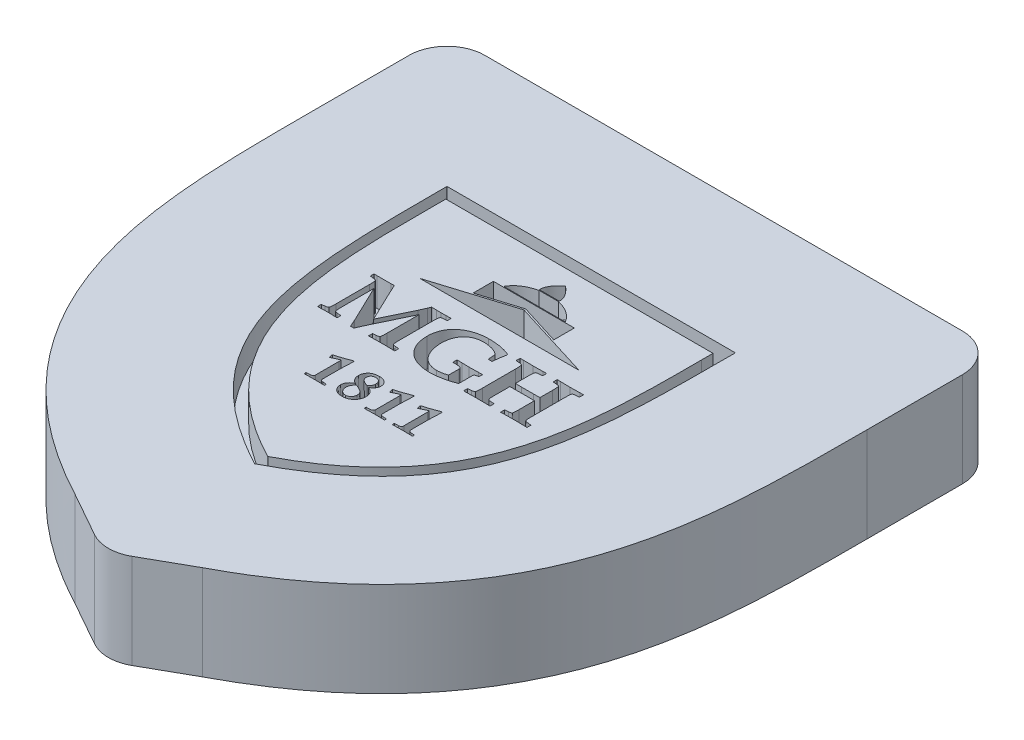
from build123d import *

# Parameters (mm, degrees)
SKETCH1_W           = 40
SKETCH1_H           = 40
BOSS_EXTRUDE1_DEPTH = 5
CUT_EXTRUDE1_START  = -1.5
CUT_EXTRUDE1_DEPTH  = 1.5
SKETCH4_W           = 40
SKETCH4_H           = 40
CUT_EXTRUDE2_DEPTH  = 29.722813372
FILLET1_R           = 2


# Read off the part's stored shape, not the designer's step: Cut-Extrude1
with BuildPart() as part:
    # Sketch1 → Boss-Extrude1 (new body)
    with BuildSketch(Plane(origin=(0, 0, 0), x_dir=(1, 0, 0), z_dir=(0, 1, 0))):
        Rectangle(SKETCH1_W, SKETCH1_H)
    extrude(amount=BOSS_EXTRUDE1_DEPTH)

    # Cut-Extrude1 outline → Cut-Extrude1 (cut)
    # profile 1 of 12: a face of its own
    with BuildSketch(Plane(origin=(0, 5, 0), x_dir=(1, 0, 0), z_dir=(0, 1, 0)).offset(CUT_EXTRUDE1_START)):
        with BuildLine():
            Line((-7.62, 8.88893), (-7.62, 8.85189))
            add(Edge.make_bspline(
                [(-7.62, 8.85189), (-7.62, 0.58209), (-7.62, -4.87999), (-0.01692, -8.88047)],
                knots=[0.125, 0.125, 0.125, 0.125, 0.25, 0.25, 0.25, 0.25], degree=3))
            Line((-0.01692, -8.88047), (0, -8.88999))
            Line((0, -8.88999), (0.01692, -8.88047))
            add(Edge.make_bspline(
                [(0.01692, -8.88047), (7.62, -4.89691), (7.62, 0.57361), (7.62, 8.85401)],
                knots=[0.5, 0.5, 0.5, 0.5, 0.625, 0.625, 0.625, 0.625], degree=3))
            Line((7.62, 8.85401), (7.62, 8.89105))
            Line((7.62, 8.89105), (-7.62, 8.88893))
        make_face()
        with BuildLine():
            add(Edge.make_bspline(
                [(-7.06968, 8.25181), (-7.06968, 8.02533), (-7.06968, 7.79885), (-7.07072, 7.57341)],
                knots=[0.25, 0.25, 0.25, 0.25, 0.333333333, 0.333333333, 0.333333333, 0.333333333], degree=3))
            Line((-7.06968, 8.25181), (-7.06968, 8.27721))
            Line((-7.06968, 8.27721), (7.0506, 8.27933))
            Line((7.0506, 8.27933), (7.0506, 7.66337))
            add(Edge.make_bspline(
                [(0.01692, -8.20103), (7.06436, -4.54027), (7.058, 1.38853), (7.0506, 7.66337)],
                knots=[0.75, 0.75, 0.75, 0.75, 0.833333333, 0.833333333, 0.833333333, 0.833333333], degree=3))
            Line((0.01692, -8.20103), (0.00528, -8.20739))
            Line((0.00528, -8.20739), (-0.00636, -8.20103))
            add(Edge.make_bspline(
                [(-4.09892, -5.06307), (-3.048, -6.29815), (-1.7092, -7.32471), (-0.00636, -8.20103)],
                knots=[0.5, 0.5, 0.5, 0.5, 0.583333333, 0.583333333, 0.583333333, 0.583333333], degree=3))
            add(Edge.make_bspline(
                [(-6.19864, -1.25095), (-5.72452, -2.71355), (-5.03764, -3.96027), (-4.09892, -5.06307)],
                knots=[0.416666667, 0.416666667, 0.416666667, 0.416666667, 0.5, 0.5, 0.5, 0.5], degree=3))
            add(Edge.make_bspline(
                [(-7.07072, 7.57341), (-7.076, 4.43337), (-7.08024, 1.46789), (-6.19864, -1.25095)],
                knots=[0.333333333, 0.333333333, 0.333333333, 0.333333333, 0.416666667, 0.416666667, 0.416666667, 0.416666667], degree=3))
        make_face(mode=Mode.SUBTRACT)
    # profile 2 of 12: a face of its own
    with BuildSketch(Plane(origin=(0, 5, 0), x_dir=(1, 0, 0), z_dir=(0, 1, 0)).offset(CUT_EXTRUDE1_START)):
        with BuildLine():
            add(Edge.make_bspline(
                [(-0.1334, -2.87547), (-0.1334, -2.58867), (-0.33132, -2.44579), (-0.48264, -2.39075)],
                knots=[0.555555556, 0.555555556, 0.555555556, 0.555555556, 0.666666667, 0.666666667, 0.666666667, 0.666666667], degree=3))
            add(Edge.make_bspline(
                [(-0.48264, -2.39075), (-0.32496, -2.29019), (-0.21804, -2.16531), (-0.21804, -2.00551)],
                knots=[0.666666667, 0.666666667, 0.666666667, 0.666666667, 0.777777778, 0.777777778, 0.777777778, 0.777777778], degree=3))
            add(Edge.make_bspline(
                [(-0.21804, -2.00551), (-0.218, -1.71875), (-0.44768, -1.59279), (-0.70804, -1.59279)],
                knots=[0.777777778, 0.777777778, 0.777777778, 0.777777778, 1, 1, 1, 1], degree=3))
            add(Edge.make_bspline(
                [(-0.70804, -1.59279), (-1.09008, -1.59279), (-1.30388, -1.80551), (-1.30388, -2.11559)],
                knots=[0, 0, 0, 0, 0.111111111, 0.111111111, 0.111111111, 0.111111111], degree=3))
            add(Edge.make_bspline(
                [(-1.30388, -2.11559), (-1.30388, -2.31775), (-1.19804, -2.45639), (-1.02344, -2.54843)],
                knots=[0.111111111, 0.111111111, 0.111111111, 0.111111111, 0.222222222, 0.222222222, 0.222222222, 0.222222222], degree=3))
            add(Edge.make_bspline(
                [(-1.02344, -2.54843), (-1.20336, -2.62779), (-1.3526, -2.79927), (-1.3526, -3.00459)],
                knots=[0.222222222, 0.222222222, 0.222222222, 0.222222222, 0.333333333, 0.333333333, 0.333333333, 0.333333333], degree=3))
            add(Edge.make_bspline(
                [(-1.3526, -3.00459), (-1.3526, -3.24591), (-1.18116, -3.49671), (-0.7864, -3.49671)],
                knots=[0.333333333, 0.333333333, 0.333333333, 0.333333333, 0.444444444, 0.444444444, 0.444444444, 0.444444444], degree=3))
            add(Edge.make_bspline(
                [(-0.7864, -3.49671), (-0.42656, -3.49671), (-0.1334, -3.24375), (-0.1334, -2.87547)],
                knots=[0.444444444, 0.444444444, 0.444444444, 0.444444444, 0.555555556, 0.555555556, 0.555555556, 0.555555556], degree=3))
        make_face()
        with BuildLine():
            add(Edge.make_bspline(
                [(-0.4424, -3.03107), (-0.4424, -3.20251), (-0.56624, -3.35175), (-0.74404, -3.35175)],
                knots=[0.166666667, 0.166666667, 0.166666667, 0.166666667, 0.333333333, 0.333333333, 0.333333333, 0.333333333], degree=3))
            add(Edge.make_bspline(
                [(-0.74404, -3.35175), (-0.95464, -3.35175), (-1.10068, -3.18243), (-1.10068, -2.97711)],
                knots=[0.333333333, 0.333333333, 0.333333333, 0.333333333, 0.5, 0.5, 0.5, 0.5], degree=3))
            add(Edge.make_bspline(
                [(-1.10068, -2.97711), (-1.10068, -2.80459), (-1.03296, -2.70619), (-0.907, -2.59927)],
                knots=[0.5, 0.5, 0.5, 0.5, 0.666666667, 0.666666667, 0.666666667, 0.666666667], degree=3))
            Line((-0.907, -2.59927), (-0.73556, -2.67547))
            add(Edge.make_bspline(
                [(-0.73556, -2.67547), (-0.57576, -2.74639), (-0.4424, -2.83423), (-0.4424, -3.03107)],
                knots=[0, 0, 0, 0, 0.166666667, 0.166666667, 0.166666667, 0.166666667], degree=3))
        make_face(mode=Mode.SUBTRACT)
        with BuildLine():
            add(Edge.make_bspline(
                [(-1.01388, -1.98863), (-1.01388, -1.82883), (-0.89852, -1.73887), (-0.744, -1.73887)],
                knots=[0.166666667, 0.166666667, 0.166666667, 0.166666667, 0.333333333, 0.333333333, 0.333333333, 0.333333333], degree=3))
            add(Edge.make_bspline(
                [(-0.744, -1.73887), (-0.56092, -1.73887), (-0.454, -1.86799), (-0.454, -2.04471)],
                knots=[0.333333333, 0.333333333, 0.333333333, 0.333333333, 0.5, 0.5, 0.5, 0.5], degree=3))
            add(Edge.make_bspline(
                [(-0.454, -2.04471), (-0.454, -2.15795), (-0.51116, -2.25639), (-0.62016, -2.34315)],
                knots=[0.5, 0.5, 0.5, 0.5, 0.666666667, 0.666666667, 0.666666667, 0.666666667], degree=3))
            Line((-0.62016, -2.34315), (-0.744, -2.29131))
            add(Edge.make_bspline(
                [(-0.744, -2.29131), (-0.87628, -2.23415), (-1.01388, -2.15795), (-1.01388, -1.98863)],
                knots=[0, 0, 0, 0, 0.166666667, 0.166666667, 0.166666667, 0.166666667], degree=3))
        make_face(mode=Mode.SUBTRACT)
    # profile 3 of 12: a face of its own
    with BuildSketch(Plane(origin=(0, 5, 0), x_dir=(1, 0, 0), z_dir=(0, 1, 0)).offset(CUT_EXTRUDE1_START)):
        with BuildLine():
            Line((2.59816, -1.59279), (2.56428, -1.56315))
            add(Edge.make_bspline(
                [(2.56428, -1.56315), (2.32296, -1.65947), (1.92928, -1.79915), (1.72292, -1.84783)],
                knots=[0.764705882, 0.764705882, 0.764705882, 0.764705882, 0.823529412, 0.823529412, 0.823529412, 0.823529412], degree=3))
            add(Edge.make_bspline(
                [(1.72292, -1.84783), (1.71976, -1.90711), (1.7314, -1.96955), (1.76312, -2.04467)],
                knots=[0.823529412, 0.823529412, 0.823529412, 0.823529412, 0.882352941, 0.882352941, 0.882352941, 0.882352941], degree=3))
            Line((1.76312, -2.04467), (2.15584, -1.86267))
            add(Edge.make_bspline(
                [(2.15584, -1.86267), (2.20028, -1.84255), (2.19816, -1.90711), (2.19816, -1.96639)],
                knots=[0, 0, 0, 0, 0.058823529, 0.058823529, 0.058823529, 0.058823529], degree=3))
            Line((2.19816, -1.96639), (2.19816, -3.21203))
            add(Edge.make_bspline(
                [(2.19816, -3.21203), (2.19816, -3.30727), (2.12832, -3.33903), (2.03836, -3.34431)],
                knots=[0.117647059, 0.117647059, 0.117647059, 0.117647059, 0.176470588, 0.176470588, 0.176470588, 0.176470588], degree=3))
            Line((2.03836, -3.34431), (1.8362, -3.35279))
            Line((1.8362, -3.35279), (1.8362, -3.45755))
            add(Edge.make_bspline(
                [(1.8362, -3.45755), (2.16536, -3.45439), (2.28704, -3.44907), (2.40664, -3.44907)],
                knots=[0.294117647, 0.294117647, 0.294117647, 0.294117647, 0.352941176, 0.352941176, 0.352941176, 0.352941176], degree=3))
            add(Edge.make_bspline(
                [(2.40664, -3.44907), (2.53048, -3.44907), (2.649, -3.45435), (2.90616, -3.45755)],
                knots=[0.352941176, 0.352941176, 0.352941176, 0.352941176, 0.411764706, 0.411764706, 0.411764706, 0.411764706], degree=3))
            Line((2.90616, -3.45755), (2.90616, -3.35279))
            Line((2.90616, -3.35279), (2.73048, -3.34431))
            add(Edge.make_bspline(
                [(2.73048, -3.34431), (2.64052, -3.33903), (2.5696, -3.30831), (2.5696, -3.21203)],
                knots=[0.529411765, 0.529411765, 0.529411765, 0.529411765, 0.588235294, 0.588235294, 0.588235294, 0.588235294], degree=3))
            Line((2.5696, -3.21203), (2.5696, -2.30611))
            add(Edge.make_bspline(
                [(2.5696, -2.30611), (2.5696, -1.96955), (2.58864, -1.72827), (2.59816, -1.59279)],
                knots=[0.647058824, 0.647058824, 0.647058824, 0.647058824, 0.705882353, 0.705882353, 0.705882353, 0.705882353], degree=3))
        make_face()
    # profile 4 of 12: a face of its own
    with BuildSketch(Plane(origin=(0, 5, 0), x_dir=(1, 0, 0), z_dir=(0, 1, 0)).offset(CUT_EXTRUDE1_START)):
        with BuildLine():
            Line((1.11444, -1.59279), (1.08056, -1.56315))
            add(Edge.make_bspline(
                [(1.08056, -1.56315), (0.83924, -1.65947), (0.44556, -1.79915), (0.2392, -1.84783)],
                knots=[0.764705882, 0.764705882, 0.764705882, 0.764705882, 0.823529412, 0.823529412, 0.823529412, 0.823529412], degree=3))
            add(Edge.make_bspline(
                [(0.2392, -1.84783), (0.23708, -1.90711), (0.24768, -1.96955), (0.2794, -2.04467)],
                knots=[0.823529412, 0.823529412, 0.823529412, 0.823529412, 0.882352941, 0.882352941, 0.882352941, 0.882352941], degree=3))
            Line((0.2794, -2.04467), (0.67204, -1.86267))
            add(Edge.make_bspline(
                [(0.67204, -1.86267), (0.71648, -1.84255), (0.71436, -1.90711), (0.71436, -1.96639)],
                knots=[0, 0, 0, 0, 0.058823529, 0.058823529, 0.058823529, 0.058823529], degree=3))
            Line((0.71436, -1.96639), (0.71436, -3.21203))
            add(Edge.make_bspline(
                [(0.71436, -3.21203), (0.71436, -3.30727), (0.64452, -3.33903), (0.55456, -3.34431)],
                knots=[0.117647059, 0.117647059, 0.117647059, 0.117647059, 0.176470588, 0.176470588, 0.176470588, 0.176470588], degree=3))
            Line((0.55456, -3.34431), (0.35136, -3.35279))
            Line((0.35136, -3.35279), (0.35136, -3.45755))
            add(Edge.make_bspline(
                [(0.35136, -3.45755), (0.68052, -3.45439), (0.8022, -3.44907), (0.92288, -3.44907)],
                knots=[0.294117647, 0.294117647, 0.294117647, 0.294117647, 0.352941176, 0.352941176, 0.352941176, 0.352941176], degree=3))
            add(Edge.make_bspline(
                [(0.92288, -3.44907), (1.04672, -3.44907), (1.16524, -3.45435), (1.4224, -3.45755)],
                knots=[0.352941176, 0.352941176, 0.352941176, 0.352941176, 0.411764706, 0.411764706, 0.411764706, 0.411764706], degree=3))
            Line((1.4224, -3.45755), (1.4224, -3.35279))
            Line((1.4224, -3.35279), (1.24672, -3.34431))
            add(Edge.make_bspline(
                [(1.24672, -3.34431), (1.15676, -3.33903), (1.08692, -3.30831), (1.08692, -3.21203)],
                knots=[0.529411765, 0.529411765, 0.529411765, 0.529411765, 0.588235294, 0.588235294, 0.588235294, 0.588235294], degree=3))
            Line((1.08692, -3.21203), (1.08692, -2.30611))
            add(Edge.make_bspline(
                [(1.08692, -2.30611), (1.08692, -1.96955), (1.10596, -1.72827), (1.11444, -1.59279)],
                knots=[0.647058824, 0.647058824, 0.647058824, 0.647058824, 0.705882353, 0.705882353, 0.705882353, 0.705882353], degree=3))
        make_face()
    # profile 5 of 12: a face of its own
    with BuildSketch(Plane(origin=(0, 5, 0), x_dir=(1, 0, 0), z_dir=(0, 1, 0)).offset(CUT_EXTRUDE1_START)):
        with BuildLine():
            add(Edge.make_bspline(
                [(-1.6478, 0.20109), (-1.74624, 0.20849), (-1.7928, 0.22333), (-1.8076, 0.24977)],
                knots=[0.924242424, 0.924242424, 0.924242424, 0.924242424, 0.939393939, 0.939393939, 0.939393939, 0.939393939], degree=3))
            add(Edge.make_bspline(
                [(-1.8076, 0.24977), (-1.83088, 0.29633), (-1.83512, 0.41381), (-1.83512, 0.58845)],
                knots=[0.939393939, 0.939393939, 0.939393939, 0.939393939, 0.954545455, 0.954545455, 0.954545455, 0.954545455], degree=3))
            Line((-1.83512, 0.58845), (-1.83512, 2.34529))
            add(Edge.make_bspline(
                [(-1.83512, 2.34529), (-1.83304, 2.52097), (-1.8288, 2.63421), (-1.80552, 2.68181)],
                knots=[0.96969697, 0.96969697, 0.96969697, 0.96969697, 1, 1, 1, 1], degree=3))
            add(Edge.make_bspline(
                [(-1.80552, 2.68181), (-1.78964, 2.71357), (-1.75788, 2.73365), (-1.64572, 2.74321)],
                knots=[0, 0, 0, 0, 0.015151515, 0.015151515, 0.015151515, 0.015151515], degree=3))
            Line((-1.64572, 2.74321), (-1.46688, 2.75801))
            Line((-1.46688, 2.75801), (-1.46688, 2.95909))
            Line((-1.46688, 2.95909), (-1.48912, 2.95909))
            add(Edge.make_bspline(
                [(-1.48912, 2.95909), (-1.57908, 2.95697), (-1.65844, 2.95485), (-1.73044, 2.95169)],
                knots=[0.060606061, 0.060606061, 0.060606061, 0.060606061, 0.075757576, 0.075757576, 0.075757576, 0.075757576], degree=3))
            add(Edge.make_bspline(
                [(-1.73044, 2.95169), (-1.82888, 2.94853), (-1.9146, 2.94533), (-1.98868, 2.94533)],
                knots=[0.075757576, 0.075757576, 0.075757576, 0.075757576, 0.090909091, 0.090909091, 0.090909091, 0.090909091], degree=3))
            add(Edge.make_bspline(
                [(-1.98868, 2.94533), (-2.06172, 2.94533), (-2.14848, 2.94849), (-2.24796, 2.95169)],
                knots=[0.090909091, 0.090909091, 0.090909091, 0.090909091, 0.106060606, 0.106060606, 0.106060606, 0.106060606], degree=3))
            add(Edge.make_bspline(
                [(-2.24796, 2.95169), (-2.31888, 2.95381), (-2.39612, 2.95697), (-2.48292, 2.95805)],
                knots=[0.106060606, 0.106060606, 0.106060606, 0.106060606, 0.121212121, 0.121212121, 0.121212121, 0.121212121], degree=3))
            Line((-2.48292, 2.95805), (-2.49772, 2.95805))
            Line((-2.49772, 2.95805), (-2.503, 2.94429))
            add(Edge.make_bspline(
                [(-2.503, 2.94429), (-2.52204, 2.90089), (-2.54112, 2.85537), (-2.56016, 2.80777)],
                knots=[0.151515152, 0.151515152, 0.151515152, 0.151515152, 0.166666667, 0.166666667, 0.166666667, 0.166666667], degree=3))
            add(Edge.make_bspline(
                [(-2.56016, 2.80777), (-2.60884, 2.69137), (-2.6586, 2.57069), (-2.7136, 2.45853)],
                knots=[0.166666667, 0.166666667, 0.166666667, 0.166666667, 0.181818182, 0.181818182, 0.181818182, 0.181818182], degree=3))
            Line((-2.7136, 2.45853), (-3.483, 0.87101))
            Line((-3.483, 0.87101), (-4.1434, 2.25109))
            add(Edge.make_bspline(
                [(-4.1434, 2.25109), (-4.17408, 2.31669), (-4.21112, 2.39609), (-4.25136, 2.47969)],
                knots=[0.212121212, 0.212121212, 0.212121212, 0.212121212, 0.227272727, 0.227272727, 0.227272727, 0.227272727], degree=3))
            add(Edge.make_bspline(
                [(-4.25136, 2.47969), (-4.3286, 2.64269), (-4.4154, 2.82789), (-4.46728, 2.94429)],
                knots=[0.227272727, 0.227272727, 0.227272727, 0.227272727, 0.242424242, 0.242424242, 0.242424242, 0.242424242], degree=3))
            Line((-4.46728, 2.94429), (-4.47364, 2.95805))
            Line((-4.47364, 2.95805), (-4.4874, 2.95805))
            add(Edge.make_bspline(
                [(-4.4874, 2.95805), (-4.53504, 2.95701), (-4.58264, 2.95489), (-4.63132, 2.95381)],
                knots=[0.272727273, 0.272727273, 0.272727273, 0.272727273, 0.287878788, 0.287878788, 0.287878788, 0.287878788], degree=3))
            add(Edge.make_bspline(
                [(-4.63132, 2.95381), (-4.87368, 2.94533), (-5.1298, 2.94429), (-5.37532, 2.95381)],
                knots=[0.287878788, 0.287878788, 0.287878788, 0.287878788, 0.303030303, 0.303030303, 0.303030303, 0.303030303], degree=3))
            add(Edge.make_bspline(
                [(-5.37532, 2.95381), (-5.424, 2.95485), (-5.47164, 2.95697), (-5.52032, 2.95805)],
                knots=[0.303030303, 0.303030303, 0.303030303, 0.303030303, 0.318181818, 0.318181818, 0.318181818, 0.318181818], degree=3))
            Line((-5.52032, 2.95805), (-5.54256, 2.95805))
            Line((-5.54256, 2.95805), (-5.54256, 2.75697))
            Line((-5.54256, 2.75697), (-5.36372, 2.74217))
            add(Edge.make_bspline(
                [(-5.36372, 2.74217), (-5.2526, 2.73369), (-5.22084, 2.71253), (-5.20392, 2.68185)],
                knots=[0.363636364, 0.363636364, 0.363636364, 0.363636364, 0.378787879, 0.378787879, 0.378787879, 0.378787879], degree=3))
            add(Edge.make_bspline(
                [(-5.20392, 2.68185), (-5.18168, 2.63317), (-5.1764, 2.52097), (-5.1764, 2.34213)],
                knots=[0.378787879, 0.378787879, 0.378787879, 0.378787879, 0.393939394, 0.393939394, 0.393939394, 0.393939394], degree=3))
            Line((-5.1764, 2.34213), (-5.1764, 0.58529))
            add(Edge.make_bspline(
                [(-5.1764, 0.58529), (-5.1764, 0.41065), (-5.18064, 0.29317), (-5.20392, 0.24769)],
                knots=[0.409090909, 0.409090909, 0.409090909, 0.409090909, 0.424242424, 0.424242424, 0.424242424, 0.424242424], degree=3))
            add(Edge.make_bspline(
                [(-5.20392, 0.24769), (-5.22084, 0.21489), (-5.2526, 0.19373), (-5.36372, 0.18525)],
                knots=[0.424242424, 0.424242424, 0.424242424, 0.424242424, 0.439393939, 0.439393939, 0.439393939, 0.439393939], degree=3))
            Line((-5.36372, 0.18525), (-5.54256, 0.17045))
            Line((-5.54256, 0.17045), (-5.54256, -0.03063))
            Line((-5.54256, -0.03063), (-5.52032, -0.03063))
            add(Edge.make_bspline(
                [(-5.52032, -0.03063), (-5.46848, -0.02959), (-5.41556, -0.02747), (-5.36264, -0.02535)],
                knots=[0.484848485, 0.484848485, 0.484848485, 0.484848485, 0.5, 0.5, 0.5, 0.5], degree=3))
            add(Edge.make_bspline(
                [(-5.36264, -0.02535), (-5.25152, -0.02111), (-5.1372, -0.01687), (-5.02608, -0.01687)],
                knots=[0.5, 0.5, 0.5, 0.5, 0.515151515, 0.515151515, 0.515151515, 0.515151515], degree=3))
            add(Edge.make_bspline(
                [(-5.02608, -0.01687), (-4.91496, -0.01687), (-4.80276, -0.02111), (-4.69376, -0.02535)],
                knots=[0.515151515, 0.515151515, 0.515151515, 0.515151515, 0.53030303, 0.53030303, 0.53030303, 0.53030303], degree=3))
            add(Edge.make_bspline(
                [(-4.69376, -0.02535), (-4.64084, -0.02747), (-4.58792, -0.02959), (-4.535, -0.03063)],
                knots=[0.53030303, 0.53030303, 0.53030303, 0.53030303, 0.545454545, 0.545454545, 0.545454545, 0.545454545], degree=3))
            Line((-4.535, -0.03063), (-4.51276, -0.03063))
            Line((-4.51276, -0.03063), (-4.51276, 0.17045))
            Line((-4.51276, 0.17045), (-4.69268, 0.18525))
            add(Edge.make_bspline(
                [(-4.69268, 0.18525), (-4.80276, 0.19373), (-4.83556, 0.21489), (-4.85248, 0.24665)],
                knots=[0.590909091, 0.590909091, 0.590909091, 0.590909091, 0.606060606, 0.606060606, 0.606060606, 0.606060606], degree=3))
            add(Edge.make_bspline(
                [(-4.85248, 0.24665), (-4.87576, 0.29321), (-4.88, 0.41069), (-4.88, 0.58533)],
                knots=[0.606060606, 0.606060606, 0.606060606, 0.606060606, 0.621212121, 0.621212121, 0.621212121, 0.621212121], degree=3))
            Line((-4.88, 0.58533), (-4.87996, 2.28813))
            Line((-4.87996, 2.28813), (-3.93064, 0.31009))
            Line((-3.93064, 0.31009), (-3.91372, 0.27409))
            add(Edge.make_bspline(
                [(-3.91372, 0.27409), (-3.86292, 0.16509), (-3.81528, 0.06241), (-3.7772, -0.04551)],
                knots=[0.666666667, 0.666666667, 0.666666667, 0.666666667, 0.681818182, 0.681818182, 0.681818182, 0.681818182], degree=3))
            Line((-3.7772, -0.04551), (-3.77192, -0.05927))
            Line((-3.77192, -0.05927), (-3.59516, -0.05927))
            Line((-3.59516, -0.05927), (-3.58988, -0.04551))
            add(Edge.make_bspline(
                [(-3.58988, -0.04551), (-3.53272, 0.09841), (-3.44808, 0.28469), (-3.33272, 0.52281)],
                knots=[0.727272727, 0.727272727, 0.727272727, 0.727272727, 0.742424242, 0.742424242, 0.742424242, 0.742424242], degree=3))
            Line((-3.33272, 0.52281), (-2.48604, 2.28493))
            Line((-2.48604, 2.28493), (-2.48604, 0.58737))
            add(Edge.make_bspline(
                [(-2.48604, 0.58737), (-2.48604, 0.41273), (-2.49028, 0.29525), (-2.51356, 0.24977)],
                knots=[0.772727273, 0.772727273, 0.772727273, 0.772727273, 0.787878788, 0.787878788, 0.787878788, 0.787878788], degree=3))
            add(Edge.make_bspline(
                [(-2.51356, 0.24977), (-2.52732, 0.22225), (-2.57388, 0.20745), (-2.67232, 0.20109)],
                knots=[0.787878788, 0.787878788, 0.787878788, 0.787878788, 0.803030303, 0.803030303, 0.803030303, 0.803030303], degree=3))
            Line((-2.67232, 0.20109), (-2.85116, 0.18629))
            Line((-2.85116, 0.18629), (-2.85116, -0.02751))
            Line((-2.85116, -0.02751), (-2.71356, -0.02435))
            add(Edge.make_bspline(
                [(-2.71356, -0.02435), (-2.55692, -0.02011), (-2.36324, -0.01483), (-2.15792, -0.01483)],
                knots=[0.848484848, 0.848484848, 0.848484848, 0.848484848, 0.863636364, 0.863636364, 0.863636364, 0.863636364], degree=3))
            add(Edge.make_bspline(
                [(-2.15792, -0.01483), (-1.95788, -0.01483), (-1.7642, -0.02011), (-1.60864, -0.02435)],
                knots=[0.863636364, 0.863636364, 0.863636364, 0.863636364, 0.878787879, 0.878787879, 0.878787879, 0.878787879], degree=3))
            Line((-1.60864, -0.02435), (-1.46788, -0.02751))
            Line((-1.46788, -0.02751), (-1.46788, 0.18629))
            Line((-1.46788, 0.18629), (-1.6478, 0.20109))
        make_face()
    # profile 6 of 12: a face of its own
    with BuildSketch(Plane(origin=(0, 5, 0), x_dir=(1, 0, 0), z_dir=(0, 1, 0)).offset(CUT_EXTRUDE1_START)):
        with BuildLine():
            add(Edge.make_bspline(
                [(-1.29016, 1.51233), (-1.29016, 0.52489), (-0.62872, -0.08891), (0.436, -0.08891)],
                knots=[0.71875, 0.71875, 0.71875, 0.71875, 0.75, 0.75, 0.75, 0.75], degree=3))
            add(Edge.make_bspline(
                [(0.436, -0.08891), (0.83816, -0.08891), (1.25196, -0.00423), (1.70072, 0.16933)],
                knots=[0.75, 0.75, 0.75, 0.75, 0.78125, 0.78125, 0.78125, 0.78125], degree=3))
            Line((1.70072, 0.16933), (1.71448, 0.17461))
            Line((1.71448, 0.17461), (1.71448, 0.89217))
            add(Edge.make_bspline(
                [(1.71448, 0.89217), (1.71448, 0.98001), (1.76632, 0.99481), (1.91768, 1.02553)],
                knots=[0.84375, 0.84375, 0.84375, 0.84375, 0.875, 0.875, 0.875, 0.875], degree=3))
            Line((1.91768, 1.02553), (1.9346, 1.02869))
            Line((1.9346, 1.02869), (1.9346, 1.21497))
            Line((1.9346, 1.21497), (1.91348, 1.21389))
            add(Edge.make_bspline(
                [(1.91348, 1.21389), (1.85316, 1.21285), (1.78964, 1.21073), (1.72404, 1.20965)],
                knots=[0, 0, 0, 0, 0.03125, 0.03125, 0.03125, 0.03125], degree=3))
            add(Edge.make_bspline(
                [(1.72404, 1.20965), (1.56104, 1.20541), (1.39068, 1.20117), (1.2404, 1.20117)],
                knots=[0.03125, 0.03125, 0.03125, 0.03125, 0.0625, 0.0625, 0.0625, 0.0625], degree=3))
            add(Edge.make_bspline(
                [(1.2404, 1.20117), (1.11128, 1.20117), (0.979, 1.20433), (0.85092, 1.20857)],
                knots=[0.0625, 0.0625, 0.0625, 0.0625, 0.09375, 0.09375, 0.09375, 0.09375], degree=3))
            Line((0.85092, 1.20857), (0.60856, 1.21493))
            Line((0.60856, 1.21493), (0.58632, 1.21493))
            Line((0.58632, 1.21493), (0.58632, 0.99585))
            Line((0.58632, 0.99585), (0.83396, 0.98633))
            add(Edge.make_bspline(
                [(0.83396, 0.98633), (0.98, 0.98105), (1.05832, 0.95669), (1.05832, 0.84769)],
                knots=[0.21875, 0.21875, 0.21875, 0.21875, 0.25, 0.25, 0.25, 0.25], degree=3))
            Line((1.05832, 0.84769), (1.05832, 0.29525))
            add(Edge.make_bspline(
                [(1.05832, 0.29525), (0.87312, 0.22645), (0.70588, 0.19365), (0.5334, 0.19365)],
                knots=[0.28125, 0.28125, 0.28125, 0.28125, 0.3125, 0.3125, 0.3125, 0.3125], degree=3))
            add(Edge.make_bspline(
                [(0.5334, 0.19365), (-0.3048, 0.19365), (-0.6022, 0.93341), (-0.6022, 1.56737)],
                knots=[0.3125, 0.3125, 0.3125, 0.3125, 0.34375, 0.34375, 0.34375, 0.34375], degree=3))
            add(Edge.make_bspline(
                [(-0.6022, 1.56737), (-0.6022, 2.28705), (-0.19156, 2.73365), (0.46988, 2.73365)],
                knots=[0.34375, 0.34375, 0.34375, 0.34375, 0.375, 0.375, 0.375, 0.375], degree=3))
            add(Edge.make_bspline(
                [(0.46988, 2.73365), (0.85616, 2.73365), (1.2012, 2.62253), (1.3536, 2.44897)],
                knots=[0.375, 0.375, 0.375, 0.375, 0.40625, 0.40625, 0.40625, 0.40625], degree=3))
            Line((1.3536, 2.44897), (1.37476, 2.08701))
            Line((1.37476, 2.08701), (1.37584, 2.06797))
            Line((1.37584, 2.06797), (1.5822, 2.06797))
            Line((1.5822, 2.06797), (1.59172, 2.15369))
            add(Edge.make_bspline(
                [(1.59172, 2.15369), (1.61396, 2.34421), (1.64568, 2.60561), (1.68272, 2.74213)],
                knots=[0.53125, 0.53125, 0.53125, 0.53125, 0.5625, 0.5625, 0.5625, 0.5625], degree=3))
            Line((1.68272, 2.74213), (1.68588, 2.75061))
            Line((1.68588, 2.75061), (1.652, 2.81093))
            Line((1.652, 2.81093), (1.64564, 2.81409))
            add(Edge.make_bspline(
                [(1.64564, 2.81409), (1.20856, 2.99401), (0.79792, 3.01833), (0.45396, 3.01833)],
                knots=[0.65625, 0.65625, 0.65625, 0.65625, 0.6875, 0.6875, 0.6875, 0.6875], degree=3))
            add(Edge.make_bspline(
                [(0.45396, 3.01833), (-0.41388, 3.01833), (-1.29016, 2.55265), (-1.29016, 1.51233)],
                knots=[0.6875, 0.6875, 0.6875, 0.6875, 0.71875, 0.71875, 0.71875, 0.71875], degree=3))
        make_face()
    # profile 7 of 12: a face of its own
    with BuildSketch(Plane(origin=(0, 5, 0), x_dir=(1, 0, 0), z_dir=(0, 1, 0)).offset(CUT_EXTRUDE1_START)):
        with BuildLine():
            add(Edge.make_bspline(
                [(5.3478, 0.19681), (5.24724, 0.20529), (5.20068, 0.21905), (5.188, 0.24657)],
                knots=[0.923076923, 0.923076923, 0.923076923, 0.923076923, 0.938461538, 0.938461538, 0.938461538, 0.938461538], degree=3))
            add(Edge.make_bspline(
                [(5.188, 0.24657), (5.16156, 0.29633), (5.15944, 0.42965), (5.15944, 0.58525)],
                knots=[0.938461538, 0.938461538, 0.938461538, 0.938461538, 0.953846154, 0.953846154, 0.953846154, 0.953846154], degree=3))
            Line((5.15944, 0.58525), (5.15944, 2.34209))
            add(Edge.make_bspline(
                [(5.15944, 2.34209), (5.16148, 2.49873), (5.1636, 2.63209), (5.19008, 2.68181)],
                knots=[0.969230769, 0.969230769, 0.969230769, 0.969230769, 1, 1, 1, 1], degree=3))
            add(Edge.make_bspline(
                [(5.19008, 2.68181), (5.20384, 2.70825), (5.25148, 2.72309), (5.34988, 2.73049)],
                knots=[0, 0, 0, 0, 0.015384615, 0.015384615, 0.015384615, 0.015384615], degree=3))
            Line((5.34988, 2.73049), (5.53084, 2.74529))
            Line((5.53084, 2.74529), (5.53084, 2.95801))
            Line((5.53084, 2.95801), (5.5086, 2.95801))
            add(Edge.make_bspline(
                [(5.5086, 2.95801), (5.45992, 2.95697), (5.407, 2.95589), (5.34984, 2.95485)],
                knots=[0.061538462, 0.061538462, 0.061538462, 0.061538462, 0.076923077, 0.076923077, 0.076923077, 0.076923077], degree=3))
            add(Edge.make_bspline(
                [(5.34984, 2.95485), (5.1964, 2.95061), (5.02068, 2.94637), (4.83444, 2.94637)],
                knots=[0.076923077, 0.076923077, 0.076923077, 0.076923077, 0.092307692, 0.092307692, 0.092307692, 0.092307692], degree=3))
            add(Edge.make_bspline(
                [(4.83444, 2.94637), (4.645, 2.94637), (4.47036, 2.95061), (4.3148, 2.95485)],
                knots=[0.092307692, 0.092307692, 0.092307692, 0.092307692, 0.107692308, 0.107692308, 0.107692308, 0.107692308], degree=3))
            add(Edge.make_bspline(
                [(4.3148, 2.95485), (4.25764, 2.95589), (4.20472, 2.95801), (4.15712, 2.95801)],
                knots=[0.107692308, 0.107692308, 0.107692308, 0.107692308, 0.123076923, 0.123076923, 0.123076923, 0.123076923], degree=3))
            Line((4.15712, 2.95801), (4.13488, 2.95801))
            Line((4.13488, 2.95801), (4.13488, 2.74529))
            Line((4.13488, 2.74529), (4.3148, 2.73049))
            add(Edge.make_bspline(
                [(4.3148, 2.73049), (4.41428, 2.72309), (4.46192, 2.70825), (4.47568, 2.68181)],
                knots=[0.169230769, 0.169230769, 0.169230769, 0.169230769, 0.184615385, 0.184615385, 0.184615385, 0.184615385], degree=3))
            add(Edge.make_bspline(
                [(4.47568, 2.68181), (4.50108, 2.63101), (4.5032, 2.49237), (4.5032, 2.34209)],
                knots=[0.184615385, 0.184615385, 0.184615385, 0.184615385, 0.2, 0.2, 0.2, 0.2], degree=3))
            Line((4.5032, 2.34209), (4.5032, 1.68169))
            add(Edge.make_bspline(
                [(4.5032, 1.68169), (4.44076, 1.67853), (4.35608, 1.67429), (4.173, 1.67429)],
                knots=[0.215384615, 0.215384615, 0.215384615, 0.215384615, 0.230769231, 0.230769231, 0.230769231, 0.230769231], degree=3))
            Line((4.173, 1.67429), (3.53696, 1.67429))
            add(Edge.make_bspline(
                [(3.53696, 1.67429), (3.35388, 1.67429), (3.2692, 1.67853), (3.20676, 1.68169)],
                knots=[0.246153846, 0.246153846, 0.246153846, 0.246153846, 0.261538462, 0.261538462, 0.261538462, 0.261538462], degree=3))
            Line((3.20676, 1.68169), (3.20676, 2.34209))
            add(Edge.make_bspline(
                [(3.20676, 2.34209), (3.20676, 2.49873), (3.20888, 2.63209), (3.23428, 2.68181)],
                knots=[0.276923077, 0.276923077, 0.276923077, 0.276923077, 0.292307692, 0.292307692, 0.292307692, 0.292307692], degree=3))
            add(Edge.make_bspline(
                [(3.23428, 2.68181), (3.24804, 2.70825), (3.29568, 2.72309), (3.3962, 2.73049)],
                knots=[0.292307692, 0.292307692, 0.292307692, 0.292307692, 0.307692308, 0.307692308, 0.307692308, 0.307692308], degree=3))
            Line((3.3962, 2.73049), (3.57612, 2.74529))
            Line((3.57612, 2.74529), (3.57612, 2.95801))
            Line((3.57612, 2.95801), (3.55388, 2.95801))
            add(Edge.make_bspline(
                [(3.55388, 2.95801), (3.5052, 2.95697), (3.45124, 2.95589), (3.39408, 2.95485)],
                knots=[0.353846154, 0.353846154, 0.353846154, 0.353846154, 0.369230769, 0.369230769, 0.369230769, 0.369230769], degree=3))
            add(Edge.make_bspline(
                [(3.39408, 2.95485), (3.24064, 2.95061), (3.066, 2.94637), (2.88184, 2.94637)],
                knots=[0.369230769, 0.369230769, 0.369230769, 0.369230769, 0.384615385, 0.384615385, 0.384615385, 0.384615385], degree=3))
            add(Edge.make_bspline(
                [(2.88184, 2.94637), (2.6924, 2.94637), (2.51564, 2.95061), (2.36112, 2.95485)],
                knots=[0.384615385, 0.384615385, 0.384615385, 0.384615385, 0.4, 0.4, 0.4, 0.4], degree=3))
            add(Edge.make_bspline(
                [(2.36112, 2.95485), (2.30504, 2.95589), (2.25212, 2.95801), (2.20344, 2.95801)],
                knots=[0.4, 0.4, 0.4, 0.4, 0.415384615, 0.415384615, 0.415384615, 0.415384615], degree=3))
            Line((2.20344, 2.95801), (2.1812, 2.95801))
            Line((2.1812, 2.95801), (2.1812, 2.74529))
            Line((2.1812, 2.74529), (2.36216, 2.73049))
            add(Edge.make_bspline(
                [(2.36216, 2.73049), (2.4606, 2.72309), (2.50928, 2.70825), (2.52196, 2.68181)],
                knots=[0.461538462, 0.461538462, 0.461538462, 0.461538462, 0.476923077, 0.476923077, 0.476923077, 0.476923077], degree=3))
            add(Edge.make_bspline(
                [(2.52196, 2.68181), (2.54736, 2.63313), (2.54948, 2.49873), (2.54948, 2.34313)],
                knots=[0.476923077, 0.476923077, 0.476923077, 0.476923077, 0.492307692, 0.492307692, 0.492307692, 0.492307692], degree=3))
            Line((2.54948, 2.34313), (2.54948, 0.58629))
            add(Edge.make_bspline(
                [(2.54948, 0.58629), (2.54948, 0.42965), (2.54736, 0.29737), (2.52196, 0.24657)],
                knots=[0.507692308, 0.507692308, 0.507692308, 0.507692308, 0.523076923, 0.523076923, 0.523076923, 0.523076923], degree=3))
            add(Edge.make_bspline(
                [(2.52196, 0.24657), (2.5082, 0.21905), (2.46268, 0.20529), (2.36108, 0.19681)],
                knots=[0.523076923, 0.523076923, 0.523076923, 0.523076923, 0.538461538, 0.538461538, 0.538461538, 0.538461538], degree=3))
            Line((2.36108, 0.19681), (2.18012, 0.18305))
            Line((2.18012, 0.18305), (2.18012, -0.03179))
            Line((2.18012, -0.03179), (2.27748, -0.02863))
            add(Edge.make_bspline(
                [(2.27748, -0.02863), (2.44576, -0.02439), (2.65424, -0.01803), (2.87968, -0.01803)],
                knots=[0.584615385, 0.584615385, 0.584615385, 0.584615385, 0.6, 0.6, 0.6, 0.6], degree=3))
            add(Edge.make_bspline(
                [(2.87968, -0.01803), (3.09876, -0.01803), (3.30724, -0.02439), (3.47448, -0.02863)],
                knots=[0.6, 0.6, 0.6, 0.6, 0.615384615, 0.615384615, 0.615384615, 0.615384615], degree=3))
            Line((3.47448, -0.02863), (3.57504, -0.03179))
            Line((3.57504, -0.03179), (3.57504, 0.18305))
            Line((3.57504, 0.18305), (3.39512, 0.19681))
            add(Edge.make_bspline(
                [(3.39512, 0.19681), (3.29352, 0.20529), (3.24696, 0.21905), (3.2332, 0.24657)],
                knots=[0.661538462, 0.661538462, 0.661538462, 0.661538462, 0.676923077, 0.676923077, 0.676923077, 0.676923077], degree=3))
            add(Edge.make_bspline(
                [(3.2332, 0.24657), (3.2078, 0.29633), (3.20568, 0.42965), (3.20568, 0.58629)],
                knots=[0.676923077, 0.676923077, 0.676923077, 0.676923077, 0.692307692, 0.692307692, 0.692307692, 0.692307692], degree=3))
            Line((3.20568, 0.58629), (3.20568, 1.38429))
            add(Edge.make_bspline(
                [(3.20568, 1.38429), (3.26812, 1.38853), (3.3528, 1.39169), (3.53588, 1.39169)],
                knots=[0.707692308, 0.707692308, 0.707692308, 0.707692308, 0.723076923, 0.723076923, 0.723076923, 0.723076923], degree=3))
            Line((3.53588, 1.39169), (4.17196, 1.39169))
            add(Edge.make_bspline(
                [(4.17196, 1.39169), (4.35504, 1.39169), (4.43972, 1.38853), (4.50216, 1.38429)],
                knots=[0.738461538, 0.738461538, 0.738461538, 0.738461538, 0.753846154, 0.753846154, 0.753846154, 0.753846154], degree=3))
            Line((4.50216, 1.38429), (4.50216, 0.58629))
            add(Edge.make_bspline(
                [(4.50216, 0.58629), (4.50216, 0.43601), (4.50004, 0.29841), (4.47464, 0.24657)],
                knots=[0.769230769, 0.769230769, 0.769230769, 0.769230769, 0.784615385, 0.784615385, 0.784615385, 0.784615385], degree=3))
            add(Edge.make_bspline(
                [(4.47464, 0.24657), (4.46088, 0.21905), (4.41432, 0.20529), (4.31272, 0.19681)],
                knots=[0.784615385, 0.784615385, 0.784615385, 0.784615385, 0.8, 0.8, 0.8, 0.8], degree=3))
            Line((4.31272, 0.19681), (4.1328, 0.18305))
            Line((4.1328, 0.18305), (4.1328, -0.03179))
            Line((4.1328, -0.03179), (4.23124, -0.02863))
            add(Edge.make_bspline(
                [(4.23124, -0.02863), (4.39844, -0.02335), (4.608, -0.01803), (4.83236, -0.01803)],
                knots=[0.846153846, 0.846153846, 0.846153846, 0.846153846, 0.861538462, 0.861538462, 0.861538462, 0.861538462], degree=3))
            add(Edge.make_bspline(
                [(4.83236, -0.01803), (5.05356, -0.01803), (5.26204, -0.02439), (5.42928, -0.02863)],
                knots=[0.861538462, 0.861538462, 0.861538462, 0.861538462, 0.876923077, 0.876923077, 0.876923077, 0.876923077], degree=3))
            Line((5.42928, -0.02863), (5.52876, -0.03179))
            Line((5.52876, -0.03179), (5.52876, 0.18305))
            Line((5.52876, 0.18305), (5.3478, 0.19681))
        make_face()
    # profile 8 of 12: a face of its own
    with BuildSketch(Plane(origin=(0, 5, 0), x_dir=(1, 0, 0), z_dir=(0, 1, 0)).offset(CUT_EXTRUDE1_START)):
        with BuildLine():
            Line((-2.0616, -1.59279), (-2.09652, -1.56315))
            add(Edge.make_bspline(
                [(-2.09652, -1.56315), (-2.33888, -1.65947), (-2.73152, -1.79915), (-2.93684, -1.84783)],
                knots=[0.764705882, 0.764705882, 0.764705882, 0.764705882, 0.823529412, 0.823529412, 0.823529412, 0.823529412], degree=3))
            add(Edge.make_bspline(
                [(-2.93684, -1.84783), (-2.94108, -1.90711), (-2.92836, -1.96955), (-2.89768, -2.04467)],
                knots=[0.823529412, 0.823529412, 0.823529412, 0.823529412, 0.882352941, 0.882352941, 0.882352941, 0.882352941], degree=3))
            Line((-2.89768, -2.04467), (-2.504, -1.86267))
            add(Edge.make_bspline(
                [(-2.504, -1.86267), (-2.45956, -1.84255), (-2.46168, -1.90711), (-2.46168, -1.96639)],
                knots=[0, 0, 0, 0, 0.058823529, 0.058823529, 0.058823529, 0.058823529], degree=3))
            Line((-2.46168, -1.96639), (-2.46168, -3.21203))
            add(Edge.make_bspline(
                [(-2.46168, -3.21203), (-2.46168, -3.30727), (-2.53152, -3.33903), (-2.62148, -3.34431)],
                knots=[0.117647059, 0.117647059, 0.117647059, 0.117647059, 0.176470588, 0.176470588, 0.176470588, 0.176470588], degree=3))
            Line((-2.62148, -3.34431), (-2.82468, -3.35279))
            Line((-2.82468, -3.35279), (-2.82468, -3.45755))
            add(Edge.make_bspline(
                [(-2.82468, -3.45755), (-2.49552, -3.45439), (-2.37384, -3.44907), (-2.25316, -3.44907)],
                knots=[0.294117647, 0.294117647, 0.294117647, 0.294117647, 0.352941176, 0.352941176, 0.352941176, 0.352941176], degree=3))
            add(Edge.make_bspline(
                [(-2.25316, -3.44907), (-2.12932, -3.44907), (-2.0108, -3.45435), (-1.75468, -3.45755)],
                knots=[0.352941176, 0.352941176, 0.352941176, 0.352941176, 0.411764706, 0.411764706, 0.411764706, 0.411764706], degree=3))
            Line((-1.75468, -3.45755), (-1.75468, -3.35279))
            Line((-1.75468, -3.35279), (-1.93036, -3.34431))
            add(Edge.make_bspline(
                [(-1.93036, -3.34431), (-2.01928, -3.33903), (-2.09016, -3.30831), (-2.09016, -3.21203)],
                knots=[0.529411765, 0.529411765, 0.529411765, 0.529411765, 0.588235294, 0.588235294, 0.588235294, 0.588235294], degree=3))
            Line((-2.09016, -3.21203), (-2.09016, -2.30611))
            add(Edge.make_bspline(
                [(-2.09016, -2.30611), (-2.09016, -1.96955), (-2.07112, -1.72827), (-2.0616, -1.59279)],
                knots=[0.647058824, 0.647058824, 0.647058824, 0.647058824, 0.705882353, 0.705882353, 0.705882353, 0.705882353], degree=3))
        make_face()
    # profile 9 of 12: a face of its own
    with BuildSketch(Plane(origin=(0, 5, 0), x_dir=(1, 0, 0), z_dir=(0, 1, 0)).offset(CUT_EXTRUDE1_START)):
        with BuildLine():
            Line((0.58736, 6.56377), (-0.42332, 6.56377))
            add(Edge.make_bspline(
                [(-0.42332, 6.56377), (-0.93344, 6.44945), (-1.34832, 6.17113), (-1.54728, 5.80917)],
                knots=[0.2, 0.2, 0.2, 0.2, 0.4, 0.4, 0.4, 0.4], degree=3))
            Line((-1.54728, 5.80917), (1.71132, 5.80921))
            add(Edge.make_bspline(
                [(1.71132, 5.80921), (1.51236, 6.17113), (1.09748, 6.45053), (0.58736, 6.56377)],
                knots=[0.6, 0.6, 0.6, 0.6, 1, 1, 1, 1], degree=3))
        make_face()
    # profile 10 of 12: a face of its own
    with BuildSketch(Plane(origin=(0, 5, 0), x_dir=(1, 0, 0), z_dir=(0, 1, 0)).offset(CUT_EXTRUDE1_START)):
        with BuildLine():
            Line((-0.45824, 6.60081), (0.60856, 6.60081))
            add(Edge.make_bspline(
                [(0.60856, 6.60081), (0.61384, 6.96701), (0.31964, 7.24641), (0.06776, 7.46969)],
                knots=[0.25, 0.25, 0.25, 0.25, 0.5, 0.5, 0.5, 0.5], degree=3))
            add(Edge.make_bspline(
                [(0.06776, 7.46969), (-0.18096, 7.24217), (-0.45824, 6.97761), (-0.45824, 6.60081)],
                knots=[0.5, 0.5, 0.5, 0.5, 1, 1, 1, 1], degree=3))
        make_face()
    # profile 11 of 12: a face of its own
    with BuildSketch(Plane(origin=(0, 5, 0), x_dir=(1, 0, 0), z_dir=(0, 1, 0)).offset(CUT_EXTRUDE1_START)):
        Polygon((-2.04788, 5.77109), (-2.04788, 4.69793), (0.0688, 5.35833), (2.22672, 4.68737), (2.22672, 5.77109), align=None)
    # profile 12 of 12: a face of its own
    with BuildSketch(Plane(origin=(0, 5, 0), x_dir=(1, 0, 0), z_dir=(0, 1, 0)).offset(CUT_EXTRUDE1_START)):
        Polygon((-4.13068, 3.96029), (4.2852, 3.96029), (0.0688, 5.27049), align=None)
    extrude(amount=CUT_EXTRUDE1_DEPTH, mode=Mode.SUBTRACT)

    # Sketch4 → Cut-Extrude2 (cut, through all)
    with BuildSketch(Plane(origin=(0, 5, 0), x_dir=(1, 0, 0), z_dir=(0, 1, 0))):
        Rectangle(SKETCH4_W, SKETCH4_H)
        with BuildLine():
            add(Edge.make_bspline(
                [(-14.62, 8.85189), (-14.62, 7.675515772), (-14.620625241, 6.499119335), (-14.571745358, 4.148107104), (-14.522055222, 2.973497881), (-14.361905101, 1.214625107), (-14.294003621, 0.628289775), (-14.122847625, -0.532123769), (-14.01951479, -1.107345853), (-13.646722874, -2.815382793), (-13.314288611, -3.930517304), (-12.657006058, -5.558683214), (-12.410623902, -6.095719915), (-11.86377367, -7.145965089), (-11.566588198, -7.653266279), (-10.605163683, -9.122765451), (-9.871031665, -10.032540377), (-8.636572365, -11.297250472), (-8.201719544, -11.702843164), (-7.306165673, -12.468232205), (-6.843687719, -12.830050029), (-5.416988862, -13.859743861), (-4.413605987, -14.472006535), (-3.36932296, -15.026187512)],
                knots=[0, 0, 0, 0, 0.125, 0.125, 0.25, 0.25, 0.3125, 0.3125, 0.375, 0.375, 0.5, 0.5, 0.5625, 0.5625, 0.625, 0.625, 0.75, 0.75, 0.8125, 0.8125, 0.875, 0.875, 1, 1, 1, 1], degree=3))
            Line((-3.36932296, -15.026187512), (0, -16.921929508))
            Line((0, -16.921929508), (3.3643805, -15.028968376))
            add(Edge.make_bspline(
                [(3.3643805, -15.028968376), (5.452548178, -13.924859372), (7.371428092, -12.59370184), (9.438552588, -10.485180551), (9.833994615, -10.041741249), (10.571936874, -9.127647547), (11.261505483, -8.181882304), (11.853996553, -7.172557764), (12.397924083, -6.131437356), (12.646705813, -5.592069896), (13.755263961, -2.854214003), (14.200928959, -0.558624961), (14.521962843, 2.966316727), (14.571698639, 4.1429736), (14.620629925, 6.497766534), (14.62, 7.675897485), (14.62, 8.85401)],
                knots=[0, 0, 0, 0, 0.25, 0.25, 0.3125, 0.3125, 0.375, 0.4375, 0.4375, 0.5, 0.5, 0.75, 0.75, 0.875, 0.875, 1, 1, 1, 1], degree=3))
            Line((14.62, 8.85401), (14.62, 15.892023821))
            Line((14.62, 15.892023821), (-14.62, 15.887956314))
            Line((-14.62, 15.887956314), (-14.62, 8.85189))
        make_face(mode=Mode.SUBTRACT)
    extrude(amount=-CUT_EXTRUDE2_DEPTH, mode=Mode.SUBTRACT)

    # Fillet1
    fillet1_edges = [part.edges().sort_by_distance(p)[0] for p in [
        (14.62, 2.5, -15.892023821),
        (-14.62, 2.5, -15.887956314),
        (0, 2.5, 16.921929508),
    ]]
    fillet(fillet1_edges, radius=FILLET1_R)


solid = part.part
